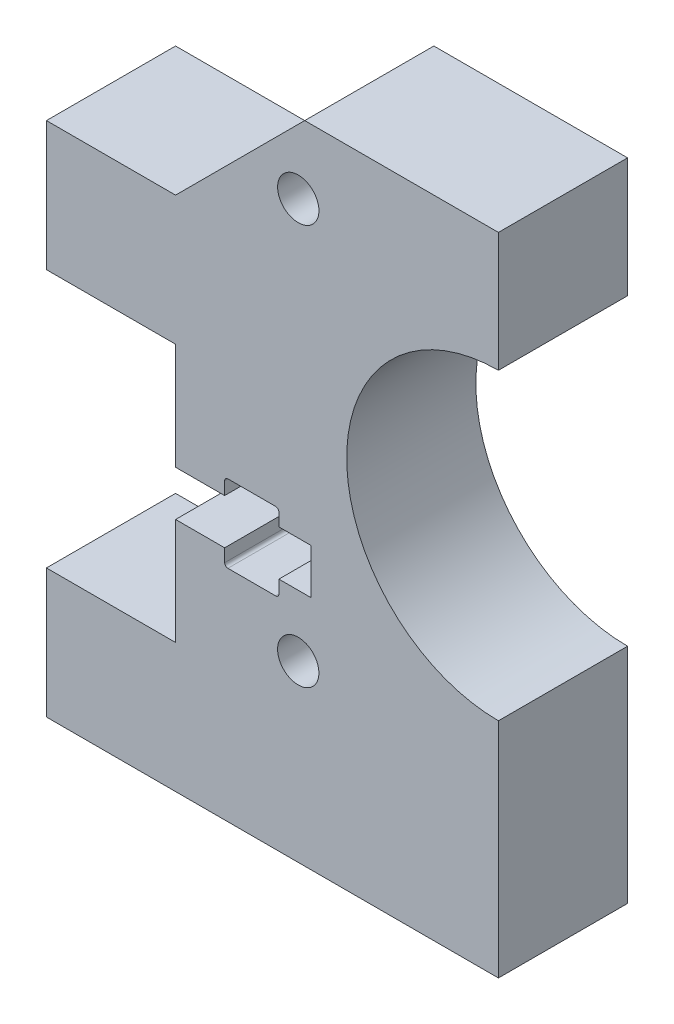
from build123d import *

# Parameters (mm, degrees)
BOSS_EXTRUDE1_DEPTH = 10
SKETCH2_R           = 11.75
SKETCH2_R_2         = 1.6
MOTOR_DEPTH         = 66.76473219
SCREW_DEPTH         = 66.76473219
SKETCH4_W           = 25
SKETCH4_H           = 10
CUT_EXTRUDE3_DEPTH  = 66.76473219


with BuildPart() as part:
    # Sketch1 → Boss-Extrude1 (new body)
    with BuildSketch(Plane.XY):
        Polygon((0, 0), (0, -10), (-10, -10), (-10, -20), (0, -20), (0, -40), (-10, -40), (-10, -50), (0, -50), (0, -60), (25, -60), (25, 0), align=None)
    extrude(amount=BOSS_EXTRUDE1_DEPTH)

    # Sketch2 → motor (cut, through all)
    with BuildSketch(Plane.XY.offset(10)):
        with Locations((25, -21)):
            Circle(SKETCH2_R)
        with Locations((9.5, -5.5)):
            Circle(SKETCH2_R_2)
        with Locations((9.5, -36.5)):
            Circle(SKETCH2_R_2)
    extrude(amount=-MOTOR_DEPTH, mode=Mode.SUBTRACT)

    # Sketch3 → screw (cut, through all)
    with BuildSketch(Plane.XY.offset(10)):
        with BuildLine():
            Line((0, -31.75), (0, -28.25))
            Line((0, -28.25), (3.8, -28.25))
            Line((3.8, -28.25), (3.8, -27.25))
            ThreePointArc((3.8, -27.25), (3.873223305, -27.073223305), (4.05, -27))
            Line((4.05, -27), (7.75, -27))
            ThreePointArc((7.75, -27), (7.926776695, -27.073223305), (8, -27.25))
            Line((8, -27.25), (8, -28.25))
            Line((8, -28.25), (10.5, -28.25))
            Line((10.5, -28.25), (10.5, -31.75))
            Line((10.5, -31.75), (8, -31.75))
            Line((8, -31.75), (8, -32.75))
            ThreePointArc((8, -32.75), (7.926776695, -32.926776695), (7.75, -33))
            Line((7.75, -33), (4.05, -33))
            ThreePointArc((4.05, -33), (3.873223305, -32.926776695), (3.8, -32.75))
            Line((3.8, -32.75), (3.8, -31.75))
            Line((3.8, -31.75), (0, -31.75))
        make_face()
    extrude(amount=-SCREW_DEPTH, mode=Mode.SUBTRACT)

    # Sketch4 → Cut-Extrude3 (cut, through all)
    with BuildSketch(Plane.XY.offset(10)):
        with Locations((12.5, -55)):
            Rectangle(SKETCH4_W, SKETCH4_H)
        Polygon((0, -10), (10, 0), (0, 0), align=None)
    extrude(amount=-CUT_EXTRUDE3_DEPTH, mode=Mode.SUBTRACT)


solid = part.part
